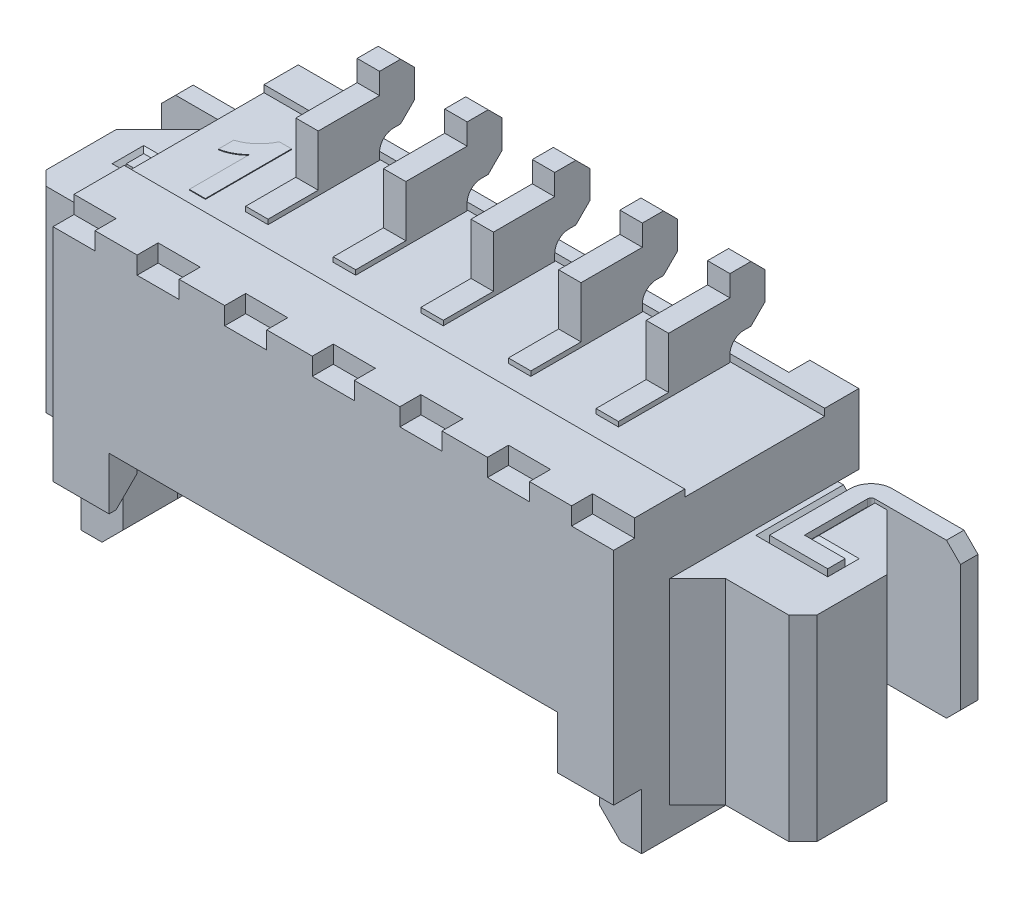
from build123d import *

# Parameters (mm, degrees)
EXTRUDE_1_DEPTH                    = 4.2
SKETCH_2_W                         = 0.6
SKETCH_2_H                         = 0.4
EXTRUDE_2_DEPTH                    = 3.4
SKETCH_3_W                         = 0.2
SKETCH_3_H                         = 0.4
EXTRUDE_3_DEPTH                    = 3.4
SKETCH_5_W                         = 6.4
SKETCH_5_H                         = 0.4
EXTRUDE_4_DEPTH                    = 2.65
CHAMFER_1_SIZE                     = 0.3
CUT_EXTRUDE_START                  = 0.2
CUT_EXTRUDE_5_DEPTH                = 0.6
SKETCH_8_W                         = 8
SKETCH_8_H                         = 3.2
EXTRUDE_7_DEPTH                    = 1.3
SKETCH_9_W                         = 0.7
SKETCH_9_H                         = 1
SKETCH_9_H_2                       = 1.3
EXTRUDE_8_DEPTH                    = 0.3
EXTRUDE_START                      = -3.3
SKETCH_11_W                        = 0.32
SKETCH_11_H                        = 0.7
EXTRUDE_10_DEPTH                   = 3
EXTRUDE_10_OTHER_WAY_DEPTH         = 0.25
EXTRUDE_10_OTHER_WAY_DRAFT         = -25
SKETCH_16_W                        = 0.6
SKETCH_16_H                        = 0.3
CUT_EXTRUDE_15_DEPTH               = 0.25
SKETCH_17_W                        = 0.6
SKETCH_17_H                        = 0.3
CUT_EXTRUDE_16_DEPTH               = 0.25
SKETCH_24_W                        = 8
SKETCH_24_H                        = 1.996235104
CUT_EXTRUDE_28_DEPTH               = 0.1
EXTRUDE_START_2                    = -0.1
EXTRUDE_29_DEPTH                   = 0.01
EXTRUDE_30_DEPTH                   = 0.32
PATTERN_LINEAR_1_COUNT             = 3
PATTERN_LINEAR_1_PITCH             = 1.25
PATTERN_LINEAR_1_COUNT_DIR2        = 3
PATTERN_LINEAR_1_PITCH_DIR2        = 1.25
PATTERN_LINEAR_17_COUNT            = 3
PATTERN_LINEAR_17_PITCH            = 1.25
PATTERN_LINEAR_17_COUNT_DIR2       = 3
PATTERN_LINEAR_17_PITCH_DIR2       = 1.25
PATTERN_START                      = -3.3
PATTERN_LINEAR_17_COPY_1_SKETCH_W  = 0.32
PATTERN_LINEAR_17_COPY_1_SKETCH_H  = 0.7
PATTERN_LINEAR_17_COPY_1_DEPTH     = 0.25
PATTERN_LINEAR_17_COPY_1_DRAFT     = -25
PATTERN_LINEAR_17_COPY_2_SKETCH_W  = 0.32
PATTERN_LINEAR_17_COPY_2_SKETCH_H  = 0.7
PATTERN_LINEAR_17_COPY_2_DEPTH     = 0.25
PATTERN_LINEAR_17_COPY_2_DRAFT     = -25
PATTERN_LINEAR_17_COPY_3_SKETCH_W  = 0.32
PATTERN_LINEAR_17_COPY_3_SKETCH_H  = 0.7
PATTERN_LINEAR_17_COPY_3_DEPTH     = 0.25
PATTERN_LINEAR_17_COPY_3_DRAFT     = -25
PATTERN_LINEAR_17_COPY_4_SKETCH_W  = 0.32
PATTERN_LINEAR_17_COPY_4_SKETCH_H  = 0.7
PATTERN_LINEAR_17_COPY_4_DEPTH     = 0.25
PATTERN_LINEAR_17_COPY_4_DRAFT     = -25
PATTERN_LINEAR_17_COPY_5_SKETCH_W  = 0.32
PATTERN_LINEAR_17_COPY_5_SKETCH_H  = 0.7
PATTERN_LINEAR_17_COPY_5_DEPTH     = 0.25
PATTERN_LINEAR_17_COPY_5_DRAFT     = -25
PATTERN_LINEAR_17_COPY_6_SKETCH_W  = 0.32
PATTERN_LINEAR_17_COPY_6_SKETCH_H  = 0.7
PATTERN_LINEAR_17_COPY_6_DEPTH     = 0.25
PATTERN_LINEAR_17_COPY_6_DRAFT     = -25
PATTERN_LINEAR_17_COPY_7_SKETCH_W  = 0.32
PATTERN_LINEAR_17_COPY_7_SKETCH_H  = 0.7
PATTERN_LINEAR_17_COPY_7_DEPTH     = 0.25
PATTERN_LINEAR_17_COPY_7_DRAFT     = -25
PATTERN_LINEAR_17_COPY_8_SKETCH_W  = 0.32
PATTERN_LINEAR_17_COPY_8_SKETCH_H  = 0.7
PATTERN_LINEAR_17_COPY_8_DEPTH     = 0.25
PATTERN_LINEAR_17_COPY_8_DRAFT     = -25
PATTERN_LINEAR_17_COPY_9_SKETCH_W  = 0.32
PATTERN_LINEAR_17_COPY_9_SKETCH_H  = 0.7
PATTERN_LINEAR_17_COPY_9_DEPTH     = 0.25
PATTERN_LINEAR_17_COPY_9_DRAFT     = -25
PATTERN_LINEAR_17_COPY_10_SKETCH_W = 0.32
PATTERN_LINEAR_17_COPY_10_SKETCH_H = 0.7
PATTERN_LINEAR_17_COPY_10_DEPTH    = 0.25
PATTERN_LINEAR_17_COPY_10_DRAFT    = -25
PATTERN_LINEAR_17_COPY_11_SKETCH_W = 0.32
PATTERN_LINEAR_17_COPY_11_SKETCH_H = 0.7
PATTERN_LINEAR_17_COPY_11_DEPTH    = 0.25
PATTERN_LINEAR_17_COPY_11_DRAFT    = -25
PATTERN_LINEAR_17_COPY_12_SKETCH_W = 0.32
PATTERN_LINEAR_17_COPY_12_SKETCH_H = 0.7
PATTERN_LINEAR_17_COPY_12_DEPTH    = 0.25
PATTERN_LINEAR_17_COPY_12_DRAFT    = -25
PATTERN_LINEAR_17_COPY_13_SKETCH_W = 0.32
PATTERN_LINEAR_17_COPY_13_SKETCH_H = 0.7
PATTERN_LINEAR_17_COPY_13_DEPTH    = 0.25
PATTERN_LINEAR_17_COPY_13_DRAFT    = -25
PATTERN_LINEAR_17_COPY_14_SKETCH_W = 0.32
PATTERN_LINEAR_17_COPY_14_SKETCH_H = 0.7
PATTERN_LINEAR_17_COPY_14_DEPTH    = 0.25
PATTERN_LINEAR_17_COPY_14_DRAFT    = -25
PATTERN_LINEAR_17_COPY_15_SKETCH_W = 0.32
PATTERN_LINEAR_17_COPY_15_SKETCH_H = 0.7
PATTERN_LINEAR_17_COPY_15_DEPTH    = 0.25
PATTERN_LINEAR_17_COPY_15_DRAFT    = -25
PATTERN_LINEAR_17_COPY_16_SKETCH_W = 0.32
PATTERN_LINEAR_17_COPY_16_SKETCH_H = 0.7
PATTERN_LINEAR_17_COPY_16_DEPTH    = 0.25
PATTERN_LINEAR_17_COPY_16_DRAFT    = -25
EXTRUDE_START_3                    = -1
EXTRUDE_31_DEPTH                   = 2.8
CUT_EXTRUDE_START_2                = -1.1
CUT_EXTRUDE_32_DEPTH               = 0.11
CUT_EXTRUDE_32_DRAFT               = -45
CUT_EXTRUDE_32_PROFILE_2_DEPTH     = 0.11
CUT_EXTRUDE_32_PROFILE_2_DRAFT     = -45
EXTRUDE_33_DEPTH                   = 2.2
CHAMFER_2_SIZE                     = 0.2


with BuildPart() as part:
    # Эскиз1 → Вытянуть1 (new body)
    with BuildSketch(Plane(origin=(0, 0, 0), x_dir=(1, 0, 0), z_dir=(0, 1, 0))):
        Polygon((3.4, -1.5), (3.4, -0.7), (-3.4, -0.7), (-3.4, -1.5), (-3.7, -1.5), (-3.7, -2.325), (-3.4, -2.325), (-3.4, -3.1), (-4, -3.1), (-4, -0.3), (4, -0.3), (4, -3.1), (3.4, -3.1), (3.4, -2.325), (3.7, -2.325), (3.7, -1.5), align=None)
    extrude(amount=-EXTRUDE_1_DEPTH)

    # Эскиз2 → Вытянуть2 (add)
    with BuildSketch(Plane(origin=(0, 0, 0), x_dir=(1, 0, 0), z_dir=(0, 1, 0))):
        with Locations((-3.7, -3.3)):
            Rectangle(SKETCH_2_W, SKETCH_2_H)
        with Locations((3.7, -3.3)):
            Rectangle(SKETCH_2_W, SKETCH_2_H)
    extrude(amount=-EXTRUDE_2_DEPTH)

    # Эскиз3 → Вытянуть3 (add)
    with BuildSketch(Plane(origin=(0, 0, 0), x_dir=(1, 0, 0), z_dir=(0, 1, 0))):
        with Locations((-3.3, -3.3)):
            Rectangle(SKETCH_3_W, SKETCH_3_H)
        with Locations((3.3, -3.3)):
            Rectangle(SKETCH_3_W, SKETCH_3_H)
    extrude(amount=-EXTRUDE_3_DEPTH)

    # Эскиз5 → Вытянуть4 (add)
    with BuildSketch(Plane(origin=(0, 0, 0), x_dir=(1, 0, 0), z_dir=(0, 1, 0))):
        with Locations((0, -3.3)):
            Rectangle(SKETCH_5_W, SKETCH_5_H)
    extrude(amount=-EXTRUDE_4_DEPTH)

    # Фаска1
    chamfer_1_edges = [part.edges().sort_by_distance(p)[0] for p in [
        (0, -2.65, 3.1),
        (3.3, -3.4, 3.1),
        (-3.3, -3.4, 3.1),
        (3.4, -4.2, 2.7125),
        (3.4, -4.2, 1.1),
        (0, -4.2, 0.7),
        (-3.4, -4.2, 1.1),
        (-3.4, -4.2, 2.7125),
    ]]
    chamfer(chamfer_1_edges, length=CHAMFER_1_SIZE)

    # Эскиз6 → Вытянуть5 (cut)
    with BuildSketch(Plane.XY.offset(CUT_EXTRUDE_START)):
        Polygon((-2.5, -1.55), (-1.25, -1.55), (-1.25, -2.7), (-1.715, -2.7), (-1.715, -4.572919328), (-2.035, -4.572919328), (-2.035, -2.7), (-2.5, -2.7), align=None)
        Polygon((1.715, -4.572919328), (1.715, -2.7), (1.25, -2.7), (1.25, -1.55), (2.5, -1.55), (2.5, -2.7), (2.035, -2.7), (2.035, -4.572919328), align=None)
    extrude(amount=CUT_EXTRUDE_5_DEPTH, mode=Mode.SUBTRACT)

    # Эскиз8 → Вытянуть7 (add)
    with BuildSketch(Plane(origin=(0, 0, 0), x_dir=(1, 0, 0), z_dir=(0, 1, 0))):
        with Locations((0, -1.9)):
            Rectangle(SKETCH_8_W, SKETCH_8_H)
    extrude(amount=-EXTRUDE_7_DEPTH)

    # Эскиз9 → Вытянуть8 (add)
    with BuildSketch(Plane.XY):
        with Locations((-3.65, -0.5)):
            Rectangle(SKETCH_9_W, SKETCH_9_H)
        with Locations((3.65, -0.5)):
            Rectangle(SKETCH_9_W, SKETCH_9_H)
        with Locations((-3.65, -3.55)):
            Rectangle(SKETCH_9_W, SKETCH_9_H_2)
        with Locations((3.65, -3.55)):
            Rectangle(SKETCH_9_W, SKETCH_9_H_2)
    extrude(amount=EXTRUDE_8_DEPTH)

    # Эскиз11 → Вытянуть10 (add)
    with BuildSketch(Plane(origin=(0, 0, 0), x_dir=(1, 0, 0), z_dir=(0, 1, 0)).offset(EXTRUDE_START)):
        with Locations((0, -1.425)):
            Rectangle(SKETCH_11_W, SKETCH_11_H)
    extrude_10 = extrude(amount=EXTRUDE_10_DEPTH)


with BuildPart() as extrude_10_other_way_tool:
    # Эскиз11 → Вытянуть10 other way (with draft: the straight prism first)
    with BuildSketch(Plane(origin=(0, 0, 0), x_dir=(1, 0, 0), z_dir=(0, 1, 0)).offset(EXTRUDE_START)):
        with Locations((0, -1.425)):
            Rectangle(SKETCH_11_W, SKETCH_11_H)
    extrude(amount=-EXTRUDE_10_OTHER_WAY_DEPTH)
    # Вытянуть10 other way: the draft: its side faces are tilted about the plane it starts from
    extrude_10_other_way_sides = [extrude_10_other_way_tool.faces().sort_by_distance(p)[0] for p in [
        (-0.16, -3.425, 1.425),
        (0, -3.425, 1.775),
        (0.16, -3.425, 1.425),
        (0, -3.425, 1.075),
    ]]
    draft(extrude_10_other_way_sides, Plane(origin=(0, 0, 0), x_dir=(1, 0, 0), z_dir=(0, 1, 0)).offset(EXTRUDE_START), EXTRUDE_10_OTHER_WAY_DRAFT)


with BuildPart() as part_1:
    add(part.part)

    # Вытянуть10 other way: add extrude_10_other_way_tool
    add(extrude_10_other_way_tool.part)

    # Эскиз16 → Вытянуть15 (cut)
    with BuildSketch(Plane(origin=(0, 0, 0), x_dir=(1, 0, 0), z_dir=(0, 1, 0))):
        with Locations((0, -3.35)):
            Rectangle(SKETCH_16_W, SKETCH_16_H)
    cut_extrude_15 = extrude(amount=-CUT_EXTRUDE_15_DEPTH, mode=Mode.SUBTRACT)

    # Эскиз17 → Вытянуть16 (cut)
    with BuildSketch(Plane(origin=(0, 0, 0), x_dir=(1, 0, 0), z_dir=(0, 1, 0))):
        with Locations((3.7, -3.35)):
            Rectangle(SKETCH_17_W, SKETCH_17_H)
        with Locations((-3.7, -3.35)):
            Rectangle(SKETCH_17_W, SKETCH_17_H)
    extrude(amount=-CUT_EXTRUDE_16_DEPTH, mode=Mode.SUBTRACT)

    # Эскиз24 → Вытянуть28 (cut)
    with BuildSketch(Plane(origin=(0, 0, 0), x_dir=(1, 0, 0), z_dir=(0, 1, 0))):
        with Locations((0, -1.486484466)):
            Rectangle(SKETCH_24_W, SKETCH_24_H)
    extrude(amount=-CUT_EXTRUDE_28_DEPTH, mode=Mode.SUBTRACT)

    # Эскиз19 → Вытянуть29 (add)
    with BuildSketch(Plane(origin=(0, 0, 0), x_dir=(1, 0, 0), z_dir=(0, 1, 0)).offset(EXTRUDE_START_2)):
        with BuildLine():
            Line((-3.1, -2.225468119), (-3.1, -0.996137624))
            Line((-3.1, -0.996137624), (-3.27463155, -0.996137624))
            ThreePointArc((-3.27463155, -0.996137624), (-3.415743265, -1.184785562), (-3.619675847, -1.302734969))
            Line((-3.619675847, -1.302734969), (-3.619675847, -1.521634508))
            ThreePointArc((-3.619675847, -1.521634508), (-3.462519347, -1.466411018), (-3.329002562, -1.366806462))
            Line((-3.329002562, -1.366806462), (-3.329002562, -2.225468119))
            Line((-3.329002562, -2.225468119), (-3.1, -2.225468119))
        make_face()
    extrude(amount=EXTRUDE_29_DEPTH)

    # Эскиз22 → Вытянуть30 (add)
    with BuildSketch(Plane(origin=(0.16, 0, 0), x_dir=(0, 0, -1), z_dir=(1, 0, 0))):
        with BuildLine():
            Line((-1.375, 0.7), (-1.375, -0.03181925))
            Line((-1.375, -0.03181925), (-2.091037185, -0.03181925))
            Line((-2.091037185, -0.03181925), (-2.091037185, -0.2))
            Line((-2.091037185, -0.2), (-1.375, -0.2))
            Line((-1.375, -0.2), (-0.5, -0.2))
            Line((-0.5, -0.2), (-0.5, 0))
            ThreePointArc((-0.5, 0), (-0.441421356, 0.141421356), (-0.3, 0.2))
            Line((-0.3, 0.2), (-0.2, 0.2))
            Line((-0.2, 0.2), (0, 0.4))
            Line((0, 0.4), (0, 0.8))
            Line((0, 0.8), (-0.2, 1))
            Line((-0.2, 1), (-0.5, 1))
            Line((-0.5, 1), (-0.5, 0.7))
            Line((-0.5, 0.7), (-1.375, 0.7))
        make_face()
    extrude_30 = extrude(amount=-EXTRUDE_30_DEPTH)

    # Линейный массив1: Cut-Extrude 15 3 × 3
    with Locations(*[Vector(1, 0, 0) * (i * PATTERN_LINEAR_1_PITCH) + Vector(-1, 0, 0) * (j * PATTERN_LINEAR_1_PITCH_DIR2) for i in range(PATTERN_LINEAR_1_COUNT) for j in range(PATTERN_LINEAR_1_COUNT_DIR2) if (i, j) != (0, 0)]):
        add(cut_extrude_15, mode=Mode.SUBTRACT)

    # Линейный массив17: Вытянуть10, Extrude 30 3 × 3
    with Locations(*[Vector(-1, 0, 0) * (i * PATTERN_LINEAR_17_PITCH) + Vector(1, 0, 0) * (j * PATTERN_LINEAR_17_PITCH_DIR2) for i in range(PATTERN_LINEAR_17_COUNT) for j in range(PATTERN_LINEAR_17_COUNT_DIR2) if (i, j) != (0, 0)]):
        add(extrude_10)
        add(extrude_30)


with BuildPart() as pattern_linear_17_copy_1_tool:
    # Линейный массив17 copy 1 sketch → Линейный массив17 copy 1 (with draft: the straight prism first)
    with BuildSketch(Plane(origin=(1.25, 0, 0), x_dir=(1, 0, 0), z_dir=(0, 1, 0)).offset(PATTERN_START)):
        with Locations((0, -1.425)):
            Rectangle(PATTERN_LINEAR_17_COPY_1_SKETCH_W, PATTERN_LINEAR_17_COPY_1_SKETCH_H)
    extrude(amount=-PATTERN_LINEAR_17_COPY_1_DEPTH)
    # Линейный массив17 copy 1: the draft: its side faces are tilted about the plane it starts from
    pattern_linear_17_copy_1_sides = [pattern_linear_17_copy_1_tool.faces().sort_by_distance(p)[0] for p in [
        (1.09, -3.425, 1.425),
        (1.25, -3.425, 1.775),
        (1.41, -3.425, 1.425),
        (1.25, -3.425, 1.075),
    ]]
    draft(pattern_linear_17_copy_1_sides, Plane(origin=(1.25, 0, 0), x_dir=(1, 0, 0), z_dir=(0, 1, 0)).offset(PATTERN_START), PATTERN_LINEAR_17_COPY_1_DRAFT)


with BuildPart() as part_2:
    add(part_1.part)

    # Линейный массив17 copy 1: add pattern_linear_17_copy_1_tool
    add(pattern_linear_17_copy_1_tool.part)


with BuildPart() as pattern_linear_17_copy_2_tool:
    # Линейный массив17 copy 2 sketch → Линейный массив17 copy 2 (with draft: the straight prism first)
    with BuildSketch(Plane(origin=(2.5, 0, 0), x_dir=(1, 0, 0), z_dir=(0, 1, 0)).offset(PATTERN_START)):
        with Locations((0, -1.425)):
            Rectangle(PATTERN_LINEAR_17_COPY_2_SKETCH_W, PATTERN_LINEAR_17_COPY_2_SKETCH_H)
    extrude(amount=-PATTERN_LINEAR_17_COPY_2_DEPTH)
    # Линейный массив17 copy 2: the draft: its side faces are tilted about the plane it starts from
    pattern_linear_17_copy_2_sides = [pattern_linear_17_copy_2_tool.faces().sort_by_distance(p)[0] for p in [
        (2.34, -3.425, 1.425),
        (2.5, -3.425, 1.775),
        (2.66, -3.425, 1.425),
        (2.5, -3.425, 1.075),
    ]]
    draft(pattern_linear_17_copy_2_sides, Plane(origin=(2.5, 0, 0), x_dir=(1, 0, 0), z_dir=(0, 1, 0)).offset(PATTERN_START), PATTERN_LINEAR_17_COPY_2_DRAFT)


with BuildPart() as part_3:
    add(part_2.part)

    # Линейный массив17 copy 2: add pattern_linear_17_copy_2_tool
    add(pattern_linear_17_copy_2_tool.part)


with BuildPart() as pattern_linear_17_copy_3_tool:
    # Линейный массив17 copy 3 sketch → Линейный массив17 copy 3 (with draft: the straight prism first)
    with BuildSketch(Plane(origin=(-1.25, 0, 0), x_dir=(1, 0, 0), z_dir=(0, 1, 0)).offset(PATTERN_START)):
        with Locations((0, -1.425)):
            Rectangle(PATTERN_LINEAR_17_COPY_3_SKETCH_W, PATTERN_LINEAR_17_COPY_3_SKETCH_H)
    extrude(amount=-PATTERN_LINEAR_17_COPY_3_DEPTH)
    # Линейный массив17 copy 3: the draft: its side faces are tilted about the plane it starts from
    pattern_linear_17_copy_3_sides = [pattern_linear_17_copy_3_tool.faces().sort_by_distance(p)[0] for p in [
        (-1.41, -3.425, 1.425),
        (-1.25, -3.425, 1.775),
        (-1.09, -3.425, 1.425),
        (-1.25, -3.425, 1.075),
    ]]
    draft(pattern_linear_17_copy_3_sides, Plane(origin=(-1.25, 0, 0), x_dir=(1, 0, 0), z_dir=(0, 1, 0)).offset(PATTERN_START), PATTERN_LINEAR_17_COPY_3_DRAFT)


with BuildPart() as part_4:
    add(part_3.part)

    # Линейный массив17 copy 3: add pattern_linear_17_copy_3_tool
    add(pattern_linear_17_copy_3_tool.part)


with BuildPart() as pattern_linear_17_copy_4_tool:
    # Линейный массив17 copy 4 sketch → Линейный массив17 copy 4 (with draft: the straight prism first)
    with BuildSketch(Plane(origin=(0, 0, 0), x_dir=(1, 0, 0), z_dir=(0, 1, 0)).offset(PATTERN_START)):
        with Locations((0, -1.425)):
            Rectangle(PATTERN_LINEAR_17_COPY_4_SKETCH_W, PATTERN_LINEAR_17_COPY_4_SKETCH_H)
    extrude(amount=-PATTERN_LINEAR_17_COPY_4_DEPTH)
    # Линейный массив17 copy 4: the draft: its side faces are tilted about the plane it starts from
    pattern_linear_17_copy_4_sides = [pattern_linear_17_copy_4_tool.faces().sort_by_distance(p)[0] for p in [
        (-0.16, -3.425, 1.425),
        (0, -3.425, 1.775),
        (0.16, -3.425, 1.425),
        (0, -3.425, 1.075),
    ]]
    draft(pattern_linear_17_copy_4_sides, Plane(origin=(0, 0, 0), x_dir=(1, 0, 0), z_dir=(0, 1, 0)).offset(PATTERN_START), PATTERN_LINEAR_17_COPY_4_DRAFT)


with BuildPart() as part_5:
    add(part_4.part)

    # Линейный массив17 copy 4: add pattern_linear_17_copy_4_tool
    add(pattern_linear_17_copy_4_tool.part)


with BuildPart() as pattern_linear_17_copy_5_tool:
    # Линейный массив17 copy 5 sketch → Линейный массив17 copy 5 (with draft: the straight prism first)
    with BuildSketch(Plane(origin=(1.25, 0, 0), x_dir=(1, 0, 0), z_dir=(0, 1, 0)).offset(PATTERN_START)):
        with Locations((0, -1.425)):
            Rectangle(PATTERN_LINEAR_17_COPY_5_SKETCH_W, PATTERN_LINEAR_17_COPY_5_SKETCH_H)
    extrude(amount=-PATTERN_LINEAR_17_COPY_5_DEPTH)
    # Линейный массив17 copy 5: the draft: its side faces are tilted about the plane it starts from
    pattern_linear_17_copy_5_sides = [pattern_linear_17_copy_5_tool.faces().sort_by_distance(p)[0] for p in [
        (1.09, -3.425, 1.425),
        (1.25, -3.425, 1.775),
        (1.41, -3.425, 1.425),
        (1.25, -3.425, 1.075),
    ]]
    draft(pattern_linear_17_copy_5_sides, Plane(origin=(1.25, 0, 0), x_dir=(1, 0, 0), z_dir=(0, 1, 0)).offset(PATTERN_START), PATTERN_LINEAR_17_COPY_5_DRAFT)


with BuildPart() as part_6:
    add(part_5.part)

    # Линейный массив17 copy 5: add pattern_linear_17_copy_5_tool
    add(pattern_linear_17_copy_5_tool.part)


with BuildPart() as pattern_linear_17_copy_6_tool:
    # Линейный массив17 copy 6 sketch → Линейный массив17 copy 6 (with draft: the straight prism first)
    with BuildSketch(Plane(origin=(-2.5, 0, 0), x_dir=(1, 0, 0), z_dir=(0, 1, 0)).offset(PATTERN_START)):
        with Locations((0, -1.425)):
            Rectangle(PATTERN_LINEAR_17_COPY_6_SKETCH_W, PATTERN_LINEAR_17_COPY_6_SKETCH_H)
    extrude(amount=-PATTERN_LINEAR_17_COPY_6_DEPTH)
    # Линейный массив17 copy 6: the draft: its side faces are tilted about the plane it starts from
    pattern_linear_17_copy_6_sides = [pattern_linear_17_copy_6_tool.faces().sort_by_distance(p)[0] for p in [
        (-2.66, -3.425, 1.425),
        (-2.5, -3.425, 1.775),
        (-2.34, -3.425, 1.425),
        (-2.5, -3.425, 1.075),
    ]]
    draft(pattern_linear_17_copy_6_sides, Plane(origin=(-2.5, 0, 0), x_dir=(1, 0, 0), z_dir=(0, 1, 0)).offset(PATTERN_START), PATTERN_LINEAR_17_COPY_6_DRAFT)


with BuildPart() as part_7:
    add(part_6.part)

    # Линейный массив17 copy 6: add pattern_linear_17_copy_6_tool
    add(pattern_linear_17_copy_6_tool.part)


with BuildPart() as pattern_linear_17_copy_7_tool:
    # Линейный массив17 copy 7 sketch → Линейный массив17 copy 7 (with draft: the straight prism first)
    with BuildSketch(Plane(origin=(-1.25, 0, 0), x_dir=(1, 0, 0), z_dir=(0, 1, 0)).offset(PATTERN_START)):
        with Locations((0, -1.425)):
            Rectangle(PATTERN_LINEAR_17_COPY_7_SKETCH_W, PATTERN_LINEAR_17_COPY_7_SKETCH_H)
    extrude(amount=-PATTERN_LINEAR_17_COPY_7_DEPTH)
    # Линейный массив17 copy 7: the draft: its side faces are tilted about the plane it starts from
    pattern_linear_17_copy_7_sides = [pattern_linear_17_copy_7_tool.faces().sort_by_distance(p)[0] for p in [
        (-1.41, -3.425, 1.425),
        (-1.25, -3.425, 1.775),
        (-1.09, -3.425, 1.425),
        (-1.25, -3.425, 1.075),
    ]]
    draft(pattern_linear_17_copy_7_sides, Plane(origin=(-1.25, 0, 0), x_dir=(1, 0, 0), z_dir=(0, 1, 0)).offset(PATTERN_START), PATTERN_LINEAR_17_COPY_7_DRAFT)


with BuildPart() as part_8:
    add(part_7.part)

    # Линейный массив17 copy 7: add pattern_linear_17_copy_7_tool
    add(pattern_linear_17_copy_7_tool.part)


with BuildPart() as pattern_linear_17_copy_8_tool:
    # Линейный массив17 copy 8 sketch → Линейный массив17 copy 8 (with draft: the straight prism first)
    with BuildSketch(Plane(origin=(0, 0, 0), x_dir=(1, 0, 0), z_dir=(0, 1, 0)).offset(PATTERN_START)):
        with Locations((0, -1.425)):
            Rectangle(PATTERN_LINEAR_17_COPY_8_SKETCH_W, PATTERN_LINEAR_17_COPY_8_SKETCH_H)
    extrude(amount=-PATTERN_LINEAR_17_COPY_8_DEPTH)
    # Линейный массив17 copy 8: the draft: its side faces are tilted about the plane it starts from
    pattern_linear_17_copy_8_sides = [pattern_linear_17_copy_8_tool.faces().sort_by_distance(p)[0] for p in [
        (-0.16, -3.425, 1.425),
        (0, -3.425, 1.775),
        (0.16, -3.425, 1.425),
        (0, -3.425, 1.075),
    ]]
    draft(pattern_linear_17_copy_8_sides, Plane(origin=(0, 0, 0), x_dir=(1, 0, 0), z_dir=(0, 1, 0)).offset(PATTERN_START), PATTERN_LINEAR_17_COPY_8_DRAFT)


with BuildPart() as part_9:
    add(part_8.part)

    # Линейный массив17 copy 8: add pattern_linear_17_copy_8_tool
    add(pattern_linear_17_copy_8_tool.part)


with BuildPart() as pattern_linear_17_copy_9_tool:
    # Линейный массив17 copy 9 sketch → Линейный массив17 copy 9 (with draft: the straight prism first)
    with BuildSketch(Plane(origin=(1.25, 0, 0), x_dir=(1, 0, 0), z_dir=(0, 1, 0)).offset(PATTERN_START)):
        with Locations((0, -1.425)):
            Rectangle(PATTERN_LINEAR_17_COPY_9_SKETCH_W, PATTERN_LINEAR_17_COPY_9_SKETCH_H)
    extrude(amount=-PATTERN_LINEAR_17_COPY_9_DEPTH)
    # Линейный массив17 copy 9: the draft: its side faces are tilted about the plane it starts from
    pattern_linear_17_copy_9_sides = [pattern_linear_17_copy_9_tool.faces().sort_by_distance(p)[0] for p in [
        (1.09, -3.425, 1.425),
        (1.25, -3.425, 1.775),
        (1.41, -3.425, 1.425),
        (1.25, -3.425, 1.075),
    ]]
    draft(pattern_linear_17_copy_9_sides, Plane(origin=(1.25, 0, 0), x_dir=(1, 0, 0), z_dir=(0, 1, 0)).offset(PATTERN_START), PATTERN_LINEAR_17_COPY_9_DRAFT)


with BuildPart() as part_10:
    add(part_9.part)

    # Линейный массив17 copy 9: add pattern_linear_17_copy_9_tool
    add(pattern_linear_17_copy_9_tool.part)


with BuildPart() as pattern_linear_17_copy_10_tool:
    # Линейный массив17 copy 10 sketch → Линейный массив17 copy 10 (with draft: the straight prism first)
    with BuildSketch(Plane(origin=(2.5, 0, 0), x_dir=(1, 0, 0), z_dir=(0, 1, 0)).offset(PATTERN_START)):
        with Locations((0, -1.425)):
            Rectangle(PATTERN_LINEAR_17_COPY_10_SKETCH_W, PATTERN_LINEAR_17_COPY_10_SKETCH_H)
    extrude(amount=-PATTERN_LINEAR_17_COPY_10_DEPTH)
    # Линейный массив17 copy 10: the draft: its side faces are tilted about the plane it starts from
    pattern_linear_17_copy_10_sides = [pattern_linear_17_copy_10_tool.faces().sort_by_distance(p)[0] for p in [
        (2.34, -3.425, 1.425),
        (2.5, -3.425, 1.775),
        (2.66, -3.425, 1.425),
        (2.5, -3.425, 1.075),
    ]]
    draft(pattern_linear_17_copy_10_sides, Plane(origin=(2.5, 0, 0), x_dir=(1, 0, 0), z_dir=(0, 1, 0)).offset(PATTERN_START), PATTERN_LINEAR_17_COPY_10_DRAFT)


with BuildPart() as part_11:
    add(part_10.part)

    # Линейный массив17 copy 10: add pattern_linear_17_copy_10_tool
    add(pattern_linear_17_copy_10_tool.part)


with BuildPart() as pattern_linear_17_copy_11_tool:
    # Линейный массив17 copy 11 sketch → Линейный массив17 copy 11 (with draft: the straight prism first)
    with BuildSketch(Plane(origin=(-1.25, 0, 0), x_dir=(1, 0, 0), z_dir=(0, 1, 0)).offset(PATTERN_START)):
        with Locations((0, -1.425)):
            Rectangle(PATTERN_LINEAR_17_COPY_11_SKETCH_W, PATTERN_LINEAR_17_COPY_11_SKETCH_H)
    extrude(amount=-PATTERN_LINEAR_17_COPY_11_DEPTH)
    # Линейный массив17 copy 11: the draft: its side faces are tilted about the plane it starts from
    pattern_linear_17_copy_11_sides = [pattern_linear_17_copy_11_tool.faces().sort_by_distance(p)[0] for p in [
        (-1.41, -3.425, 1.425),
        (-1.25, -3.425, 1.775),
        (-1.09, -3.425, 1.425),
        (-1.25, -3.425, 1.075),
    ]]
    draft(pattern_linear_17_copy_11_sides, Plane(origin=(-1.25, 0, 0), x_dir=(1, 0, 0), z_dir=(0, 1, 0)).offset(PATTERN_START), PATTERN_LINEAR_17_COPY_11_DRAFT)


with BuildPart() as part_12:
    add(part_11.part)

    # Линейный массив17 copy 11: add pattern_linear_17_copy_11_tool
    add(pattern_linear_17_copy_11_tool.part)


with BuildPart() as pattern_linear_17_copy_12_tool:
    # Линейный массив17 copy 12 sketch → Линейный массив17 copy 12 (with draft: the straight prism first)
    with BuildSketch(Plane(origin=(0, 0, 0), x_dir=(1, 0, 0), z_dir=(0, 1, 0)).offset(PATTERN_START)):
        with Locations((0, -1.425)):
            Rectangle(PATTERN_LINEAR_17_COPY_12_SKETCH_W, PATTERN_LINEAR_17_COPY_12_SKETCH_H)
    extrude(amount=-PATTERN_LINEAR_17_COPY_12_DEPTH)
    # Линейный массив17 copy 12: the draft: its side faces are tilted about the plane it starts from
    pattern_linear_17_copy_12_sides = [pattern_linear_17_copy_12_tool.faces().sort_by_distance(p)[0] for p in [
        (-0.16, -3.425, 1.425),
        (0, -3.425, 1.775),
        (0.16, -3.425, 1.425),
        (0, -3.425, 1.075),
    ]]
    draft(pattern_linear_17_copy_12_sides, Plane(origin=(0, 0, 0), x_dir=(1, 0, 0), z_dir=(0, 1, 0)).offset(PATTERN_START), PATTERN_LINEAR_17_COPY_12_DRAFT)


with BuildPart() as part_13:
    add(part_12.part)

    # Линейный массив17 copy 12: add pattern_linear_17_copy_12_tool
    add(pattern_linear_17_copy_12_tool.part)


with BuildPart() as pattern_linear_17_copy_13_tool:
    # Линейный массив17 copy 13 sketch → Линейный массив17 copy 13 (with draft: the straight prism first)
    with BuildSketch(Plane(origin=(1.25, 0, 0), x_dir=(1, 0, 0), z_dir=(0, 1, 0)).offset(PATTERN_START)):
        with Locations((0, -1.425)):
            Rectangle(PATTERN_LINEAR_17_COPY_13_SKETCH_W, PATTERN_LINEAR_17_COPY_13_SKETCH_H)
    extrude(amount=-PATTERN_LINEAR_17_COPY_13_DEPTH)
    # Линейный массив17 copy 13: the draft: its side faces are tilted about the plane it starts from
    pattern_linear_17_copy_13_sides = [pattern_linear_17_copy_13_tool.faces().sort_by_distance(p)[0] for p in [
        (1.09, -3.425, 1.425),
        (1.25, -3.425, 1.775),
        (1.41, -3.425, 1.425),
        (1.25, -3.425, 1.075),
    ]]
    draft(pattern_linear_17_copy_13_sides, Plane(origin=(1.25, 0, 0), x_dir=(1, 0, 0), z_dir=(0, 1, 0)).offset(PATTERN_START), PATTERN_LINEAR_17_COPY_13_DRAFT)


with BuildPart() as part_14:
    add(part_13.part)

    # Линейный массив17 copy 13: add pattern_linear_17_copy_13_tool
    add(pattern_linear_17_copy_13_tool.part)


with BuildPart() as pattern_linear_17_copy_14_tool:
    # Линейный массив17 copy 14 sketch → Линейный массив17 copy 14 (with draft: the straight prism first)
    with BuildSketch(Plane(origin=(-2.5, 0, 0), x_dir=(1, 0, 0), z_dir=(0, 1, 0)).offset(PATTERN_START)):
        with Locations((0, -1.425)):
            Rectangle(PATTERN_LINEAR_17_COPY_14_SKETCH_W, PATTERN_LINEAR_17_COPY_14_SKETCH_H)
    extrude(amount=-PATTERN_LINEAR_17_COPY_14_DEPTH)
    # Линейный массив17 copy 14: the draft: its side faces are tilted about the plane it starts from
    pattern_linear_17_copy_14_sides = [pattern_linear_17_copy_14_tool.faces().sort_by_distance(p)[0] for p in [
        (-2.66, -3.425, 1.425),
        (-2.5, -3.425, 1.775),
        (-2.34, -3.425, 1.425),
        (-2.5, -3.425, 1.075),
    ]]
    draft(pattern_linear_17_copy_14_sides, Plane(origin=(-2.5, 0, 0), x_dir=(1, 0, 0), z_dir=(0, 1, 0)).offset(PATTERN_START), PATTERN_LINEAR_17_COPY_14_DRAFT)


with BuildPart() as part_15:
    add(part_14.part)

    # Линейный массив17 copy 14: add pattern_linear_17_copy_14_tool
    add(pattern_linear_17_copy_14_tool.part)


with BuildPart() as pattern_linear_17_copy_15_tool:
    # Линейный массив17 copy 15 sketch → Линейный массив17 copy 15 (with draft: the straight prism first)
    with BuildSketch(Plane(origin=(-1.25, 0, 0), x_dir=(1, 0, 0), z_dir=(0, 1, 0)).offset(PATTERN_START)):
        with Locations((0, -1.425)):
            Rectangle(PATTERN_LINEAR_17_COPY_15_SKETCH_W, PATTERN_LINEAR_17_COPY_15_SKETCH_H)
    extrude(amount=-PATTERN_LINEAR_17_COPY_15_DEPTH)
    # Линейный массив17 copy 15: the draft: its side faces are tilted about the plane it starts from
    pattern_linear_17_copy_15_sides = [pattern_linear_17_copy_15_tool.faces().sort_by_distance(p)[0] for p in [
        (-1.41, -3.425, 1.425),
        (-1.25, -3.425, 1.775),
        (-1.09, -3.425, 1.425),
        (-1.25, -3.425, 1.075),
    ]]
    draft(pattern_linear_17_copy_15_sides, Plane(origin=(-1.25, 0, 0), x_dir=(1, 0, 0), z_dir=(0, 1, 0)).offset(PATTERN_START), PATTERN_LINEAR_17_COPY_15_DRAFT)


with BuildPart() as part_16:
    add(part_15.part)

    # Линейный массив17 copy 15: add pattern_linear_17_copy_15_tool
    add(pattern_linear_17_copy_15_tool.part)


with BuildPart() as pattern_linear_17_copy_16_tool:
    # Линейный массив17 copy 16 sketch → Линейный массив17 copy 16 (with draft: the straight prism first)
    with BuildSketch(Plane(origin=(0, 0, 0), x_dir=(1, 0, 0), z_dir=(0, 1, 0)).offset(PATTERN_START)):
        with Locations((0, -1.425)):
            Rectangle(PATTERN_LINEAR_17_COPY_16_SKETCH_W, PATTERN_LINEAR_17_COPY_16_SKETCH_H)
    extrude(amount=-PATTERN_LINEAR_17_COPY_16_DEPTH)
    # Линейный массив17 copy 16: the draft: its side faces are tilted about the plane it starts from
    pattern_linear_17_copy_16_sides = [pattern_linear_17_copy_16_tool.faces().sort_by_distance(p)[0] for p in [
        (-0.16, -3.425, 1.425),
        (0, -3.425, 1.775),
        (0.16, -3.425, 1.425),
        (0, -3.425, 1.075),
    ]]
    draft(pattern_linear_17_copy_16_sides, Plane(origin=(0, 0, 0), x_dir=(1, 0, 0), z_dir=(0, 1, 0)).offset(PATTERN_START), PATTERN_LINEAR_17_COPY_16_DRAFT)


with BuildPart() as part_17:
    add(part_16.part)

    # Линейный массив17 copy 16: add pattern_linear_17_copy_16_tool
    add(pattern_linear_17_copy_16_tool.part)

    # Эскиз26 → Вытянуть31 (add)
    with BuildSketch(Plane(origin=(0, 0, 0), x_dir=(1, 0, 0), z_dir=(0, 1, 0)).offset(EXTRUDE_START_3)):
        Polygon((-5.5, -1.1), (-5.5, -2.1), (-5.3, -2.3), (-4.4, -2.3), (-4, -2.7), (-4, -0.3), (-4.7, -0.3), align=None)
        Polygon((5.5, -2.1), (5.3, -2.3), (4.4, -2.3), (4, -2.7), (4, -0.3), (4.7, -0.3), (5.5, -1.1), align=None)
    extrude(amount=-EXTRUDE_31_DEPTH)


with BuildPart() as cut_extrude_32_tool:
    # Эскиз27 → Вытянуть32 (with draft: the straight prism first)
    with BuildSketch(Plane(origin=(0, 0, 0), x_dir=(1, 0, 0), z_dir=(0, 1, 0)).offset(CUT_EXTRUDE_START_2)):
        Polygon((-4.18, -0.223112715), (-4.43, -0.223112715), (-4.43, -1.2), (-5.00579352, -1.2), (-5.00579352, -1.45), (-4.18, -1.45), align=None)
    extrude(amount=CUT_EXTRUDE_32_DEPTH)
    # Вытянуть32: the draft: its side faces are tilted about the plane it starts from
    cut_extrude_32_sides = [cut_extrude_32_tool.faces().sort_by_distance(p)[0] for p in [
        (-4.305, -1.045, 0.223112715),
        (-4.43, -1.045, 0.711556358),
        (-4.71789676, -1.045, 1.2),
        (-5.00579352, -1.045, 1.325),
        (-4.59289676, -1.045, 1.45),
        (-4.18, -1.045, 0.836556358),
    ]]
    draft(cut_extrude_32_sides, Plane(origin=(0, 0, 0), x_dir=(1, 0, 0), z_dir=(0, 1, 0)).offset(CUT_EXTRUDE_START_2), CUT_EXTRUDE_32_DRAFT)


with BuildPart() as part_18:
    add(part_17.part)

    # Вытянуть32: cut by cut_extrude_32_tool
    add(cut_extrude_32_tool.part, mode=Mode.SUBTRACT)


with BuildPart() as cut_extrude_32_profile_2_tool:
    # Эскиз27 → Вытянуть32 profile 2 (with draft: the straight prism first)
    with BuildSketch(Plane(origin=(0, 0, 0), x_dir=(1, 0, 0), z_dir=(0, 1, 0)).offset(CUT_EXTRUDE_START_2)):
        Polygon((4.43, -0.223112715), (4.18, -0.223112715), (4.18, -1.45), (5.00579352, -1.45), (5.00579352, -1.2), (4.43, -1.2), align=None)
    extrude(amount=CUT_EXTRUDE_32_PROFILE_2_DEPTH)
    # Вытянуть32 profile 2: the draft: its side faces are tilted about the plane it starts from
    cut_extrude_32_profile_2_sides = [cut_extrude_32_profile_2_tool.faces().sort_by_distance(p)[0] for p in [
        (4.305, -1.045, 0.223112715),
        (4.18, -1.045, 0.836556358),
        (4.59289676, -1.045, 1.45),
        (5.00579352, -1.045, 1.325),
        (4.71789676, -1.045, 1.2),
        (4.43, -1.045, 0.711556358),
    ]]
    draft(cut_extrude_32_profile_2_sides, Plane(origin=(0, 0, 0), x_dir=(1, 0, 0), z_dir=(0, 1, 0)).offset(CUT_EXTRUDE_START_2), CUT_EXTRUDE_32_PROFILE_2_DRAFT)


with BuildPart() as part_19:
    add(part_18.part)

    # Вытянуть32 profile 2: cut by cut_extrude_32_profile_2_tool
    add(cut_extrude_32_profile_2_tool.part, mode=Mode.SUBTRACT)

    # Эскиз28 → Вытянуть33 (add)
    with BuildSketch(Plane(origin=(0, 0, 0), x_dir=(1, 0, 0), z_dir=(0, 1, 0)).offset(EXTRUDE_START_3)):
        with BuildLine():
            Line((-5.7, 0), (-4.475, 0))
            ThreePointArc((-4.475, 0), (-4.262867966, -0.087867966), (-4.175, -0.3))
            Line((-4.175, -0.3), (-4.175, -1.45))
            Line((-4.175, -1.45), (-5.005, -1.45))
            Line((-5.005, -1.45), (-5.005, -1.2))
            Line((-5.005, -1.2), (-4.425, -1.2))
            Line((-4.425, -1.2), (-4.425, -0.3))
            ThreePointArc((-4.425, -0.3), (-4.439644661, -0.264644661), (-4.475, -0.25))
            Line((-4.475, -0.25), (-5.7, -0.25))
            Line((-5.7, -0.25), (-5.7, 0))
        make_face()
        with BuildLine():
            Line((5.7, -0.25), (5.7, 0))
            Line((5.7, 0), (4.475, 0))
            ThreePointArc((4.475, 0), (4.262867966, -0.087867966), (4.175, -0.3))
            Line((4.175, -0.3), (4.175, -1.45))
            Line((4.175, -1.45), (5.005, -1.45))
            Line((5.005, -1.45), (5.005, -1.2))
            Line((5.005, -1.2), (4.425, -1.2))
            Line((4.425, -1.2), (4.425, -0.3))
            ThreePointArc((4.425, -0.3), (4.439644661, -0.264644661), (4.475, -0.25))
            Line((4.475, -0.25), (5.7, -0.25))
        make_face()
    extrude(amount=-EXTRUDE_33_DEPTH)

    # Фаска2
    chamfer_2_edges = [part_19.edges().sort_by_distance(p)[0] for p in [
        (5.7, -1, 0.125),
        (5.7, -3.2, 0.125),
        (-5.7, -1, 0.125),
        (-5.7, -3.2, 0.125),
    ]]
    chamfer(chamfer_2_edges, length=CHAMFER_2_SIZE)


solid = part_19.part
